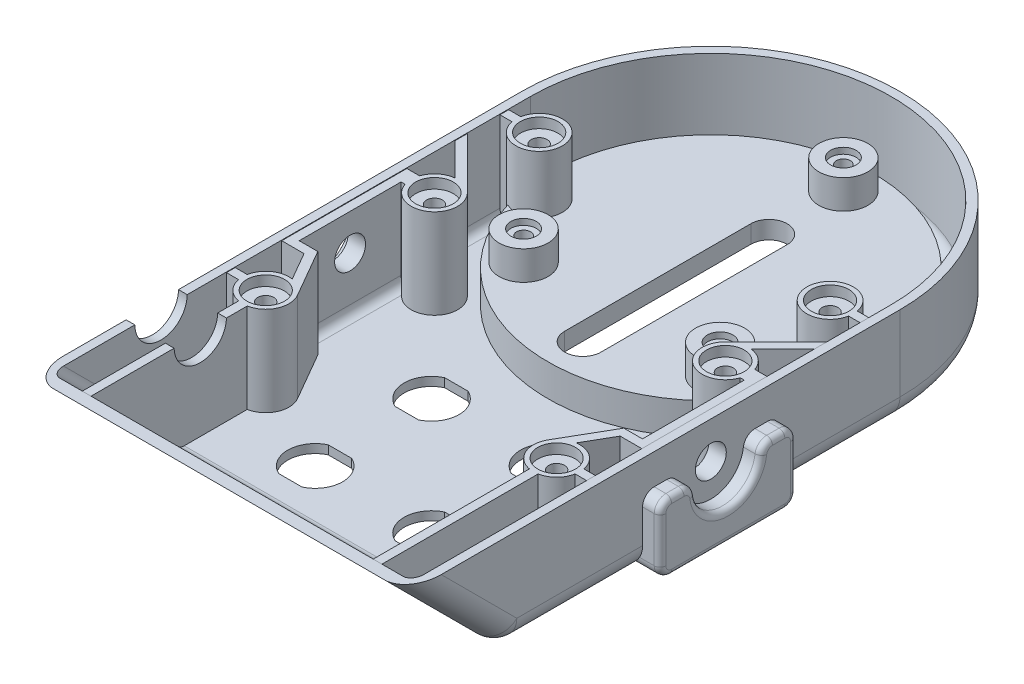
from build123d import *

# Parameters (mm, degrees)
BOSS_EXTRUDE2_DEPTH                            = 21.59
BOSS_EXTRUDE6_DEPTH                            = 41.275
SHELL1_T                                       = -1.905
SKETCH2_R                                      = 35.56
BOSS_EXTRUDE3_DEPTH                            = 4.445
SKETCH4_R                                      = 34.149999899
CUT_EXTRUDE2_DEPTH                             = 5
SKETCH6_R                                      = 5.355
BOSS_EXTRUDE4_DEPTH                            = 8.89
SKETCH35_R                                     = 3.958
CUT_EXTRUDE19_DEPTH                            = 5.668
CBORE_FOR_3_BUTTON_HEAD_CAP_SCREW4_D           = 3.048
CBORE_FOR_3_BUTTON_HEAD_CAP_SCREW4_CBORE_D     = 5.55752
CBORE_FOR_3_BUTTON_HEAD_CAP_SCREW4_CBORE_DEPTH = 1.3208
CUT_EXTRUDE7_DEPTH                             = 120.579115861
CUT_EXTRUDE8_DEPTH                             = 120.108747895
F_1_4_CLEARANCE_HOLE1_D                        = 6.7564
CUT_EXTRUDE12_REACH                            = 115.487
BOSS_EXTRUDE5_REACH                            = 121.885
SKETCH23_R                                     = 4.109999908
CUT_EXTRUDE13_DEPTH                            = 2.204999908
SKETCH27_W                                     = 22.225
SKETCH27_H                                     = 21.463
SKETCH27_R                                     = 3.3782
BOSS_EXTRUDE9_DEPTH                            = 1.905
SKETCH24_R                                     = 1.7272
CUT_EXTRUDE14_DEPTH                            = 9.525
BOSS_EXTRUDE8_DEPTH                            = 3.81
SKETCH36_OUTSIDE_W                             = 185.232
SKETCH36_OUTSIDE_H                             = 58.232
CUT_EXTRUDE20_DEPTH                            = 3.81
BOSS_EXTRUDE10_START                           = 19.558
BOSS_EXTRUDE10_DEPTH                           = 19.558
FILLET2_R                                      = 1.905
FILLET1_R                                      = 5.08
FILLET5_R                                      = 2.54
FILLET6_R                                      = 1.27
SKETCH32_R                                     = 4.109999908
CUT_EXTRUDE17_DEPTH                            = 2.204999908
SKETCH33_R                                     = 1.7272
CUT_EXTRUDE18_DEPTH                            = 9.525
CUT_EXTRUDE21_REACH                            = 143.888
SKETCH37_R                                     = 5.715
BOSS_EXTRUDE11_START                           = 6.35
BOSS_EXTRUDE11_OUTLINE_R                       = 5.355
BOSS_EXTRUDE11_DEPTH                           = 2.54
CUT_EXTRUDE22_START                            = -3
CUT_EXTRUDE22_OUTLINE_R                        = 4.299999909
CUT_EXTRUDE22_DEPTH                            = 3


# Read off the part's stored shape, not the designer's step: Boss-Extrude11, Cut-Extrude22
with BuildPart() as part:
    # Sketch1 → Boss-Extrude2 (new body)
    with BuildSketch(Plane(origin=(0, 0, 0), x_dir=(1, 0, 0), z_dir=(0, 1, 0))):
        with BuildLine():
            Line((-41.275, -88.9), (41.275, -88.9))
            Line((41.275, -88.9), (41.275, -3.175))
            ThreePointArc((41.275, -3.175), (0, 38.1), (-41.275, -3.175))
            Line((-41.275, -3.175), (-41.275, -88.9))
        make_face()
    extrude(amount=BOSS_EXTRUDE2_DEPTH)

    # Sketch19 → Boss-Extrude6 (add, symmetric)
    with BuildSketch(Plane(origin=(0, 0, 0), x_dir=(0, 0, -1), z_dir=(1, 0, 0))):
        Polygon((-88.9, 0), (-88.9, 21.59), (-110.49, 21.59), align=None)
    extrude(amount=BOSS_EXTRUDE6_DEPTH, both=True)

    # Shell1
    shell1_openings = [part.faces().sort_by_distance(p)[0] for p in [
        (0, 21.59, 40.32016302),
    ]]
    offset(amount=SHELL1_T, openings=shell1_openings, kind=Kind.INTERSECTION)

    # Sketch2 → Boss-Extrude3 (add)
    with BuildSketch(Plane(origin=(0, 1.905, 0), x_dir=(1, 0, 0), z_dir=(0, 1, 0))):
        with Locations(Location((0, -3.175, 0), (0, 0, 270))):
            Circle(SKETCH2_R)
    extrude(amount=BOSS_EXTRUDE3_DEPTH)

    # Sketch4 → Cut-Extrude2 (cut)
    with BuildSketch(Plane.XZ):
        with Locations(Location((0, 3.175, 0), (0, 0, 270))):
            Circle(SKETCH4_R)
    extrude(amount=-CUT_EXTRUDE2_DEPTH, mode=Mode.SUBTRACT)

    # Sketch6 → Boss-Extrude4 (add)
    with BuildSketch(Plane(origin=(0, 6.35, 0), x_dir=(1, 0, 0), z_dir=(0, 1, 0))):
        with Locations(Location((0, 25.760469738, 0), (0, 0, 270))):
            Circle(SKETCH6_R)
        with Locations(Location((21.45, -22.595579522, 0), (0, 0, 270))):
            Circle(SKETCH6_R)
        with Locations(Location((-21.45, -22.595579522, 0), (0, 0, 270))):
            Circle(SKETCH6_R)
    extrude(amount=BOSS_EXTRUDE4_DEPTH)

    # Sketch35 → Cut-Extrude19 (cut)
    with BuildSketch(Plane.XZ.offset(-5)):
        with Locations(Location((0, -25.760469738, 0), (0, 0, 270))):
            Circle(SKETCH35_R)
        with Locations(Location((-21.45, 22.595579522, 0), (0, 0, 270))):
            Circle(SKETCH35_R)
        with Locations(Location((21.45, 22.595579522, 0), (0, 0, 270))):
            Circle(SKETCH35_R)
    extrude(amount=-CUT_EXTRUDE19_DEPTH, mode=Mode.SUBTRACT)

    # CBORE for #3 Button Head Cap Screw4 (through all)
    with Locations(Plane(origin=(21.45, 15.24, 22.595579522), x_dir=(0, 0, 1), z_dir=(0, 1, 0))):
        with Locations((0, 0), (0, -42.9), (-48.35604926, -21.45)):
            CounterBoreHole(CBORE_FOR_3_BUTTON_HEAD_CAP_SCREW4_D / 2, CBORE_FOR_3_BUTTON_HEAD_CAP_SCREW4_CBORE_D / 2, CBORE_FOR_3_BUTTON_HEAD_CAP_SCREW4_CBORE_DEPTH)

    # Sketch14 → Cut-Extrude7 (cut, through all)
    with BuildSketch(Plane(origin=(0, 1.905, 0), x_dir=(1, 0, 0), z_dir=(0, 1, 0))):
        with BuildLine():
            Line((-15.253868379, -82.255499954), (-10.146131621, -82.255499954))
            ThreePointArc((-10.146131621, -82.255499954), (-6.708000046, -76.835), (-10.146131621, -71.414500046))
            Line((-10.146131621, -71.414500046), (-15.253868379, -71.414500046))
            ThreePointArc((-15.253868379, -71.414500046), (-18.691999954, -76.835), (-15.253868379, -82.255499954))
        make_face()
        with BuildLine():
            Line((-15.253868379, -56.855499954), (-10.146131621, -56.855499954))
            ThreePointArc((-10.146131621, -56.855499954), (-6.708000046, -51.435), (-10.146131621, -46.014500046))
            Line((-10.146131621, -46.014500046), (-15.253868379, -46.014500046))
            ThreePointArc((-15.253868379, -46.014500046), (-18.691999954, -51.435), (-15.253868379, -56.855499954))
        make_face()
        with BuildLine():
            Line((15.253868379, -82.255499954), (10.146131621, -82.255499954))
            ThreePointArc((10.146131621, -82.255499954), (6.708000046, -76.835), (10.146131621, -71.414500046))
            Line((10.146131621, -71.414500046), (15.253868379, -71.414500046))
            ThreePointArc((15.253868379, -71.414500046), (18.691999954, -76.835), (15.253868379, -82.255499954))
        make_face()
        with BuildLine():
            Line((15.253868379, -56.855499954), (10.146131621, -56.855499954))
            ThreePointArc((10.146131621, -56.855499954), (6.708000046, -51.435), (10.146131621, -46.014500046))
            Line((10.146131621, -46.014500046), (15.253868379, -46.014500046))
            ThreePointArc((15.253868379, -46.014500046), (18.691999954, -51.435), (15.253868379, -56.855499954))
        make_face()
    extrude(amount=-CUT_EXTRUDE7_DEPTH, mode=Mode.SUBTRACT)

    # Sketch15 → Cut-Extrude8 (cut, through all)
    with BuildSketch(Plane.XZ.offset(-5)):
        with BuildLine():
            Line((3.959999954, 31.115), (3.959999954, -9.525))
            ThreePointArc((3.959999954, -9.525), (0, -13.484999954), (-3.959999954, -9.525))
            Line((-3.959999954, -9.525), (-3.959999954, 31.115))
            ThreePointArc((-3.959999954, 31.115), (0, 35.074999954), (3.959999954, 31.115))
        make_face()
    extrude(amount=-CUT_EXTRUDE8_DEPTH, mode=Mode.SUBTRACT)

    # 1/4 Clearance Hole1 (through all)
    with Locations(Plane(origin=(41.275, 13.589, 44.45), x_dir=(0, 0, 1), z_dir=(1, 0, 0))):
        with Locations((0, 0)):
            Hole(F_1_4_CLEARANCE_HOLE1_D / 2)

    # Sketch20 → Cut-Extrude12 (cut, up to next)
    with BuildSketch(Plane(origin=(0, -44.45, 44.45), x_dir=(1, 0, 0), z_dir=(0, -0.7071067811865516, 0.7071067811865435)), mode=Mode.PRIVATE) as cut_extrude12_sk1:
        with BuildLine():
            Line((5.15927933, 72.225779566), (5.902448688, 72.968948923))
            Line((5.902448688, 72.968948923), (6.049526963, 72.821870647))
            ThreePointArc((6.049526963, 72.821870647), (-5.690088203, 83.818316456), (5.306357606, 72.07870129))
            Line((5.306357606, 72.07870129), (5.15927933, 72.225779566))
        make_face()
    cut_extrude12_tool1 = extrude(cut_extrude12_sk1.sketch, amount=-CUT_EXTRUDE12_REACH, mode=Mode.PRIVATE) & part.part
    add(cut_extrude12_tool1.solids().sort_by_distance((-0.006366, 10.799501, 99.699501))[0], mode=Mode.SUBTRACT)

    # Sketch18 → Boss-Extrude5 (add, up to next)
    with BuildSketch(Plane(origin=(0, 21.463, 0), x_dir=(1, 0, 0), z_dir=(0, 1, 0)), mode=Mode.PRIVATE) as boss_extrude5_sk1:
        with BuildLine():
            Line((30.7975, -73.569904182), (30.7975, -107.795923164))
            Line((30.7975, -107.795923164), (32.7025, -107.795923164))
            Line((32.7025, -107.795923164), (32.7025, -73.569904182))
            ThreePointArc((32.7025, -73.569904182), (35.342102448, -72.172102448), (36.739904182, -69.5325))
            Line((36.739904182, -69.5325), (39.37, -69.5325))
            Line((39.37, -69.5325), (39.37, -67.6275))
            Line((39.37, -67.6275), (36.739904182, -67.6275))
            ThreePointArc((36.739904182, -67.6275), (28.157897552, -64.987897552), (30.7975, -73.569904182))
        make_face()
    boss_extrude5_tool1 = extrude(boss_extrude5_sk1.sketch, amount=-BOSS_EXTRUDE5_REACH, mode=Mode.PRIVATE) - part.part
    # Sketch18 → Boss-Extrude5 (add, up to next)
    with BuildSketch(Plane(origin=(0, 21.463, 0), x_dir=(1, 0, 0), z_dir=(0, 1, 0)), mode=Mode.PRIVATE) as boss_extrude5_sk2:
        with BuildLine():
            Line((36.739904182, -7.9375), (39.37, -7.9375))
            Line((39.37, -7.9375), (39.37, -9.8425))
            Line((39.37, -9.8425), (36.739904182, -9.8425))
            ThreePointArc((36.739904182, -9.8425), (26.67, -8.89), (36.739904182, -7.9375))
        make_face()
    boss_extrude5_tool2 = extrude(boss_extrude5_sk2.sketch, amount=-BOSS_EXTRUDE5_REACH, mode=Mode.PRIVATE) - part.part
    boss_extrude5_1 = boss_extrude5_tool1.solids().sort_by_distance((31.955315, 21.463, 78.116579))[0]
    add(boss_extrude5_1)
    boss_extrude5_2 = boss_extrude5_tool2.solids().sort_by_distance((32.110756, 21.463, 8.89))[0]
    add(boss_extrude5_2)
    boss_extrude5 = boss_extrude5_1 + boss_extrude5_2  # Boss-Extrude5 as one shape, for the pattern or mirror that repeats it

    # Sketch23 → Cut-Extrude13 (cut)
    with BuildSketch(Plane(origin=(0, 21.463, 0), x_dir=(1, 0, 0), z_dir=(0, 1, 0))):
        with Locations(Location((31.75, -68.58, 0), (0, 0, 270))):
            Circle(SKETCH23_R)
        with Locations(Location((31.75, -8.89, 0), (0, 0, 90))):
            Circle(SKETCH23_R)
    cut_extrude13 = extrude(amount=-CUT_EXTRUDE13_DEPTH, mode=Mode.SUBTRACT)

    # Mirror9: Boss-Extrude5, Cut-Extrude13 across plane
    add(boss_extrude5.mirror(Plane(origin=(0, 0, 0), x_dir=(0, 0, 1), z_dir=(1, 0, 0))))
    add(cut_extrude13.mirror(Plane(origin=(0, 0, 0), x_dir=(0, 0, 1), z_dir=(1, 0, 0))), mode=Mode.SUBTRACT)

    # Sketch27 → Boss-Extrude9 (add)
    with BuildSketch(Plane(origin=(-39.37, 0, 0), x_dir=(0, 0, -1), z_dir=(1, 0, 0))):
        with Locations((-44.45, 10.7315)):
            Rectangle(SKETCH27_W, SKETCH27_H)
        with Locations((-44.45, 13.589)):
            Circle(SKETCH27_R, mode=Mode.SUBTRACT)
    boss_extrude9 = extrude(amount=BOSS_EXTRUDE9_DEPTH)

    # Mirror4: Boss-Extrude9 across plane
    add(boss_extrude9.mirror(Plane(origin=(0, 0, 0), x_dir=(0, 0, 1), z_dir=(1, 0, 0))))

    # Sketch24 → Cut-Extrude14 (cut)
    with BuildSketch(Plane(origin=(0, 19.258000092, 0), x_dir=(1, 0, 0), z_dir=(0, 1, 0))):
        with Locations(Location((-31.75, -8.89, 0), (0, 0, 270))):
            Circle(SKETCH24_R)
        with Locations(Location((31.75, -8.89, 0), (0, 0, 270))):
            Circle(SKETCH24_R)
        with Locations(Location((31.75, -68.58, 0), (0, 0, 270))):
            Circle(SKETCH24_R)
        with Locations(Location((-31.75, -68.58, 0), (0, 0, 270))):
            Circle(SKETCH24_R)
    extrude(amount=-CUT_EXTRUDE14_DEPTH, mode=Mode.SUBTRACT)

    # Sketch25 → Boss-Extrude8 (add)
    with BuildSketch(Plane.ZY.offset(41.275)):
        with BuildLine():
            Line((51.3207, 15.24), (59.644000092, 15.24))
            Line((59.644000092, 15.24), (59.644000092, 0))
            Line((59.644000092, 0), (29.255999908, 0))
            Line((29.255999908, 0), (29.255999908, 15.24))
            Line((29.255999908, 15.24), (37.5793, 15.24))
            Line((37.5793, 15.24), (37.5793, 13.589))
            ThreePointArc((37.5793, 13.589), (44.45, 6.7183), (51.3207, 13.589))
            Line((51.3207, 13.589), (51.3207, 15.24))
        make_face()
    boss_extrude8 = extrude(amount=BOSS_EXTRUDE8_DEPTH)

    # Sketch36 outside → Cut-Extrude20 (cut)
    with BuildSketch(Plane.ZY.offset(45.085)):
        with Locations((36.195, 10.795)):
            Rectangle(SKETCH36_OUTSIDE_W, SKETCH36_OUTSIDE_H)
        with BuildLine():
            Line((59.344000184, 0), (59.344000184, 14.940000092))
            Line((59.344000184, 14.940000092), (51.620699908, 14.940000092))
            Line((51.620699908, 14.940000092), (51.620699908, 13.589))
            ThreePointArc((51.620699908, 13.589), (44.45, 6.418300092), (37.279300092, 13.589))
            Line((37.279300092, 13.589), (37.279300092, 14.940000092))
            Line((37.279300092, 14.940000092), (29.555999816, 14.940000092))
            Line((29.555999816, 14.940000092), (29.555999816, 0))
            Line((29.555999816, 0), (59.344000184, 0))
        make_face(mode=Mode.SUBTRACT)
    cut_extrude20 = extrude(amount=-CUT_EXTRUDE20_DEPTH, mode=Mode.SUBTRACT)

    # Mirror1: Boss-Extrude8, Cut-Extrude20 across plane
    add(boss_extrude8.mirror(Plane(origin=(0, 0, 0), x_dir=(0, 0, 1), z_dir=(1, 0, 0))))
    add(cut_extrude20.mirror(Plane(origin=(0, 0, 0), x_dir=(0, 0, 1), z_dir=(1, 0, 0))), mode=Mode.SUBTRACT)

    # Sketch31 → Boss-Extrude10 (add)
    with BuildSketch(Plane(origin=(0, 1.905, 0), x_dir=(1, 0, 0), z_dir=(0, 1, 0)).offset(BOSS_EXTRUDE10_START)):
        with BuildLine():
            Line((-39.37, -33.3375), (-36.575582219, -33.3375))
            ThreePointArc((-36.575582219, -33.3375), (-29.087775654, -36.076541521), (-28.157897552, -28.157897552))
            Line((-28.157897552, -28.157897552), (-39.37, -16.945795103))
            Line((-39.37, -16.945795103), (-39.37, -19.639871939))
            Line((-39.37, -19.639871939), (-32.309020045, -26.700851895))
            ThreePointArc((-32.309020045, -26.700851895), (-34.950662007, -27.80510929), (-36.575582219, -30.1625))
            Line((-36.575582219, -30.1625), (-39.37, -30.1625))
            Line((-39.37, -30.1625), (-39.37, -33.3375))
        make_face()
        with BuildLine():
            Line((-39.37, -55.5625), (-33.399778394, -55.5625))
            Line((-33.399778394, -55.5625), (-27.350590949, -66.04))
            ThreePointArc((-27.350590949, -66.04), (-28.884278534, -64.38547494), (-30.983156207, -63.55821241))
            Line((-30.983156207, -63.55821241), (-34.499630657, -57.4675))
            Line((-34.499630657, -57.4675), (-39.37, -57.4675))
            Line((-39.37, -57.4675), (-39.37, -55.5625))
        make_face()
    boss_extrude10 = extrude(amount=-BOSS_EXTRUDE10_DEPTH)

    # Fillet2
    fillet2_edges = [part.edges().sort_by_distance(p)[0] for p in [
        (39.37, 1.905, 5.55625),
        (-39.37, 1.905, 5.55625),
        (0, 1.905, -36.195),
        (-39.37, 1.905, 78.821711582),
        (-36.03625, 1.905, 88.110923164),
        (36.03625, 1.905, 88.110923164),
        (39.37, 1.905, 78.821711582),
        (39.37, 1.905, 61.595),
        (39.37, 1.905, 21.59),
        (0, 1.905, 88.110923164),
        (39.37, 11.7475, 97.953423164),
        (-39.37, 11.7475, 97.953423164),
        (-37.465, 1.905, 44.45),
        (37.465, 1.905, 44.45),
        (-39.37, 1.905, 24.90118597),
        (-39.37, 1.905, 13.394147552),
        (-39.37, 1.905, 62.5475),
    ]]
    fillet(fillet2_edges, radius=FILLET2_R)

    # Fillet1
    fillet1_edges = [part.edges().sort_by_distance(p)[0] for p in [
        (-41.275, 10.795, 99.695),
        (41.275, 10.795, 99.695),
        (-41.275, 0, 16.365499908),
        (41.275, 0, 16.365499908),
        (-41.275, 0, 74.122000092),
        (0, 0, -38.1),
        (41.275, 0, 74.122000092),
        (0, 0, 88.9),
    ]]
    fillet(fillet1_edges, radius=FILLET1_R)

    # Fillet5
    fillet5_edges = [part.edges().sort_by_distance(p)[0] for p in [
        (-43.18, 14.940000092, 59.344000184),
        (-43.18, 14.940000092, 51.620699908),
        (-43.18, 14.940000092, 37.279300092),
        (-43.18, 14.940000092, 29.555999816),
        (-40.64, 0, 29.555999816),
        (-40.64, 0, 59.344000184),
        (40.64, 0, 59.344000184),
        (43.18, 14.940000092, 59.344000184),
        (43.18, 14.940000092, 51.620699908),
        (43.18, 14.940000092, 37.279300092),
        (43.18, 14.940000092, 29.555999816),
        (40.64, 0, 29.555999816),
    ]]
    fillet(fillet5_edges, radius=FILLET5_R)

    # Fillet6
    fillet6_edges = [part.edges().sort_by_distance(p)[0] for p in [
        (45.085, 7.470000046, 59.344000184),
        (45.085, 0, 44.45),
        (45.085, 7.470000046, 29.555999816),
        (45.085, 14.940000092, 33.454183354),
        (45.085, 6.418300092, 44.45),
        (45.085, 14.940000092, 55.445816646),
        (45.085, 0.743948776, 30.299948592),
        (45.085, 14.196051316, 30.299948592),
        (45.085, 14.302833295, 36.494872703),
        (45.085, 14.302833295, 52.405127297),
        (45.085, 14.196051316, 58.600051408),
        (45.085, 0.743948776, 58.600051408),
        (-45.085, 0, 44.45),
        (-45.085, 7.470000046, 59.344000184),
        (-45.085, 14.940000092, 33.454183354),
        (-45.085, 7.470000046, 29.555999816),
        (-45.085, 14.940000092, 55.445816646),
        (-45.085, 6.418300092, 44.45),
        (-45.085, 0.743948776, 58.600051408),
        (-45.085, 0.743948776, 30.299948592),
        (-45.085, 14.196051316, 30.299948592),
        (-45.085, 14.302833295, 36.494872703),
        (-45.085, 14.302833295, 52.405127297),
        (-45.085, 14.196051316, 58.600051408),
    ]]
    fillet(fillet6_edges, radius=FILLET6_R)

    # Mirror8: Boss-Extrude10 across plane
    add(boss_extrude10.mirror(Plane(origin=(0, 0, 0), x_dir=(0, 0, 1), z_dir=(1, 0, 0))))

    # Sketch32 → Cut-Extrude17 (cut)
    with BuildSketch(Plane(origin=(0, 21.463, 0), x_dir=(1, 0, 0), z_dir=(0, 1, 0))):
        with Locations(Location((-31.75, -31.75, 0), (0, 0, 270))):
            Circle(SKETCH32_R)
        with Locations(Location((31.75, -31.75, 0), (0, 0, 270))):
            Circle(SKETCH32_R)
    extrude(amount=-CUT_EXTRUDE17_DEPTH, mode=Mode.SUBTRACT)

    # Sketch33 → Cut-Extrude18 (cut)
    with BuildSketch(Plane(origin=(0, 19.258000092, 0), x_dir=(1, 0, 0), z_dir=(0, 1, 0))):
        with Locations(Location((-31.75, -31.75, 0), (0, 0, 270))):
            Circle(SKETCH33_R)
        with Locations(Location((31.75, -31.75, 0), (0, 0, 270))):
            Circle(SKETCH33_R)
    extrude(amount=-CUT_EXTRUDE18_DEPTH, mode=Mode.SUBTRACT)

    # Sketch37 → Cut-Extrude21 (cut, up to next)
    with BuildSketch(Plane.ZY.offset(41.275), mode=Mode.PRIVATE) as cut_extrude21_sk1:
        with Locations((83.82, 21.59)):
            Circle(SKETCH37_R)
    cut_extrude21_tool1 = extrude(cut_extrude21_sk1.sketch, amount=-CUT_EXTRUDE21_REACH, mode=Mode.PRIVATE) & part.part
    add(cut_extrude21_tool1.solids().sort_by_distance((-41.275, 21.59, 83.82))[0], mode=Mode.SUBTRACT)
    add(cut_extrude21_tool1.solids().sort_by_distance((-41.275, 21.59, 83.82))[1], mode=Mode.SUBTRACT)

    # Boss-Extrude11 outline → Boss-Extrude11 (add)
    with BuildSketch(Plane(origin=(0, 0, 0), x_dir=(1, 0, 0), z_dir=(0, 1, 0)).offset(BOSS_EXTRUDE11_START)):
        with BuildLine():
            ThreePointArc((35.487208798, -5.449117788), (0, 32.385), (-35.487208798, -5.449117788))
            ThreePointArc((-35.487208798, -5.449117788), (-26.750348714, -7.990062768), (-34.052795076, -13.41808291))
            ThreePointArc((-34.052795076, -13.41808291), (0, -38.735), (34.052795076, -13.41808291))
            ThreePointArc((34.052795076, -13.41808291), (26.750348714, -7.990062768), (35.487208798, -5.449117788))
        make_face()
        with Locations((-21.45, -22.595579522)):
            Circle(BOSS_EXTRUDE11_OUTLINE_R, mode=Mode.SUBTRACT)
        with Locations((21.45, -22.595579522)):
            Circle(BOSS_EXTRUDE11_OUTLINE_R, mode=Mode.SUBTRACT)
        with BuildLine():
            Line((3.959999954, 9.525), (3.959999954, -31.115))
            ThreePointArc((3.959999954, -31.115), (0, -35.074999954), (-3.959999954, -31.115))
            Line((-3.959999954, -31.115), (-3.959999954, 9.525))
            ThreePointArc((-3.959999954, 9.525), (0, 13.484999954), (3.959999954, 9.525))
        make_face(mode=Mode.SUBTRACT)
        with Locations((0, 25.760469738)):
            Circle(BOSS_EXTRUDE11_OUTLINE_R, mode=Mode.SUBTRACT)
    extrude(amount=BOSS_EXTRUDE11_DEPTH)

    # Cut-Extrude22 outline → Cut-Extrude22 (cut)
    with BuildSketch(Plane.XZ.offset(-5).offset(CUT_EXTRUDE22_START)):
        with Locations((28.75, -0.735629279)):
            Circle(CUT_EXTRUDE22_OUTLINE_R)
        with BuildLine():
            Line((-21.49299527, -4.148974995), (-15.74299527, -8.911850772))
            ThreePointArc((-15.74299527, -8.911850772), (-9.688508468, -8.34335451), (-10.25700473, -2.288867708))
            Line((-10.25700473, -2.288867708), (-16.00700473, 2.474008069))
            ThreePointArc((-16.00700473, 2.474008069), (-22.061491532, 1.905511807), (-21.49299527, -4.148974995))
        make_face()
        with Locations((17, 12.044189565)):
            Circle(CUT_EXTRUDE22_OUTLINE_R)
        with Locations((26.9, 14.049075655)):
            Circle(CUT_EXTRUDE22_OUTLINE_R)
        with Locations((-28.75, -0.735629279)):
            Circle(CUT_EXTRUDE22_OUTLINE_R)
        with Locations((-26.9, 14.049075655)):
            Circle(CUT_EXTRUDE22_OUTLINE_R)
        with Locations((13, -5.60035924)):
            Circle(CUT_EXTRUDE22_OUTLINE_R)
    extrude(amount=CUT_EXTRUDE22_DEPTH, mode=Mode.SUBTRACT)


solid = part.part
